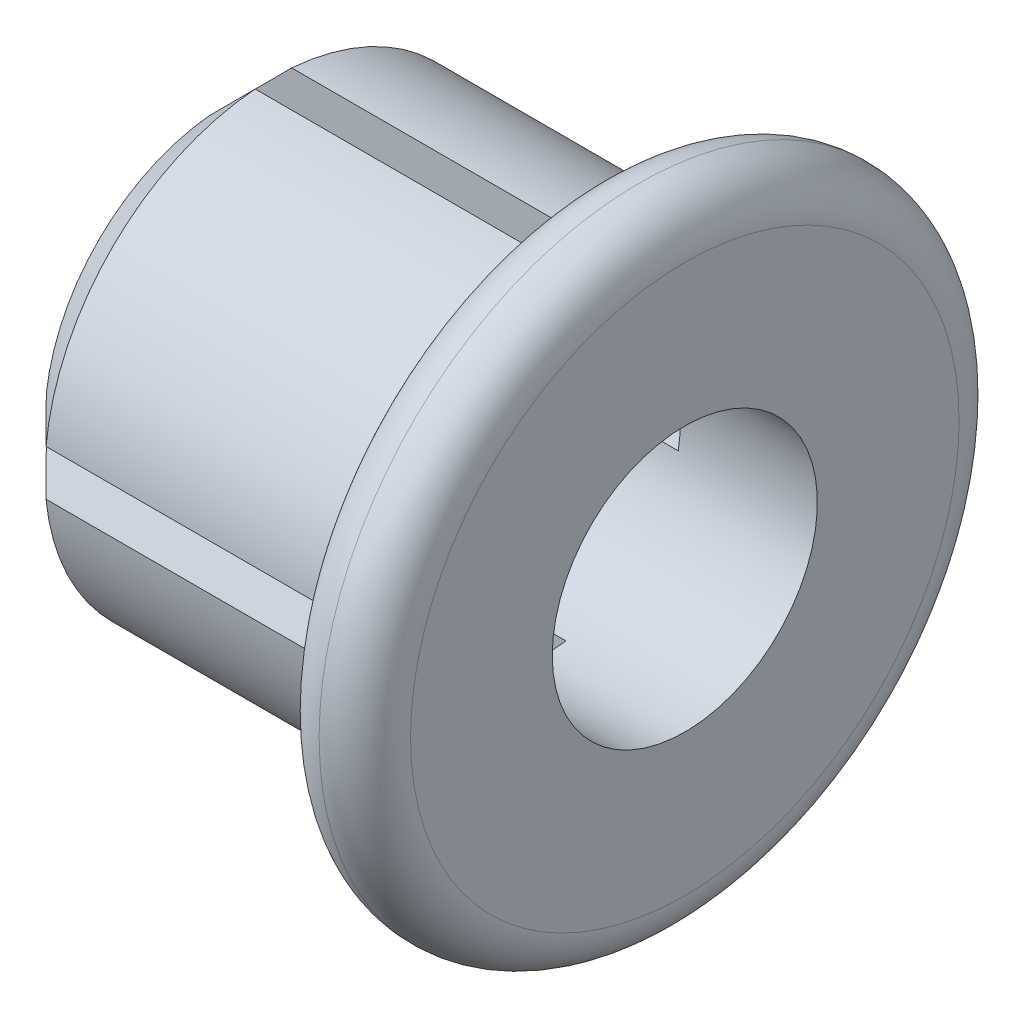
from build123d import *

# Parameters (mm, degrees)
CHAMFER_1_SIZE      = 1
FILLET_1_R          = 1
CUT_EXTRUDE_1_DEPTH = 7


with BuildPart() as part:
    # Эскиз1 → Повернуть1 (revolve)
    with BuildSketch(Plane.XY, mode=Mode.PRIVATE) as revolve_1_sk:
        Polygon((10, 2.9), (10, 7), (8, 7), (8, 5), (0, 5), (0, 2.9), align=None)
    revolve(revolve_1_sk.sketch.rotate(Axis((0, 0, 0), (1, 0, 0)), 90), axis=Axis((0, 0, 0), (1, 0, 0)))

    # Фаска1
    chamfer_1_edges = [part.edges().sort_by_distance(p)[0] for p in [
        (0, 0, -5),
    ]]
    chamfer(chamfer_1_edges, length=CHAMFER_1_SIZE)

    # Скругление1
    fillet_1_edges = [part.edges().sort_by_distance(p)[0] for p in [
        (10, 0, -7),
        (8, 0, -7),
    ]]
    fillet(fillet_1_edges, radius=FILLET_1_R - 0.0001)  # a hair under: the kernel refuses the full size

    # Эскиз2 → Вырез-Вытянуть1 (cut)
    with BuildSketch(Plane.ZY):
        Polygon((-6, -0.5), (-0.399521329, -0.5), (-0.399521329, -5.986683782), (0.399521329, -5.986683782), (0.399521329, -0.5), (6, -0.5), (6, 0.5), (0.399521329, 0.5), (0.399521329, 5.986683782), (-0.399521329, 5.986683782), (-0.399521329, 0.5), (-6, 0.5), align=None)
    extrude(amount=-CUT_EXTRUDE_1_DEPTH, mode=Mode.SUBTRACT)


solid = part.part
